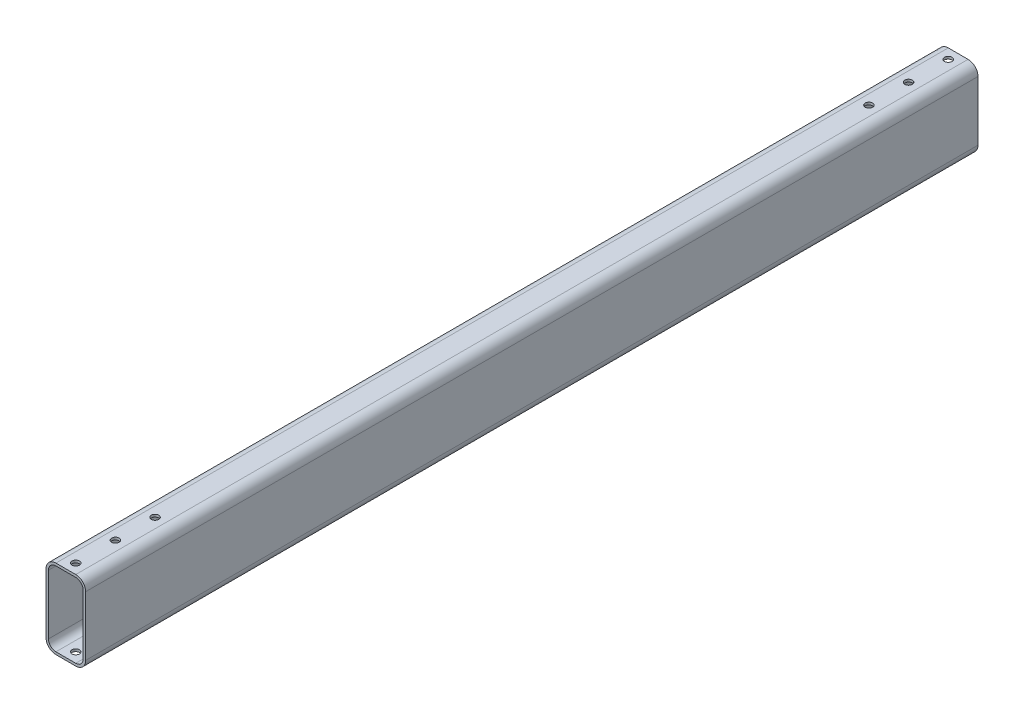
from build123d import *

# Parameters (mm, degrees)
EXTRUDE_THIN1_DEPTH            = 571.5
F_3_16_0_1875_DIAMETER_HOLE1_D = 4.7625


with BuildPart() as part:
    # Sketch1 → Extrude-Thin1 (new body)
    with BuildSketch(Plane.XY):
        with BuildLine():
            Line((-12.7, 19.05), (-12.7, -19.05))
            ThreePointArc((-12.7, -19.05), (-10.840128061, -23.540128061), (-6.35, -25.4))
            Line((-6.35, -25.4), (6.35, -25.4))
            ThreePointArc((6.35, -25.4), (10.840128061, -23.540128061), (12.7, -19.05))
            Line((12.7, -19.05), (12.7, 19.05))
            ThreePointArc((12.7, 19.05), (10.840128061, 23.540128061), (6.35, 25.4))
            Line((6.35, 25.4), (-6.35, 25.4))
            ThreePointArc((-6.35, 25.4), (-10.840128061, 23.540128061), (-12.7, 19.05))
        make_face()
        with BuildLine():
            Line((-11.1125, 19.05), (-11.1125, -19.05))
            ThreePointArc((-11.1125, -19.05), (-9.717596045, -22.417596045), (-6.35, -23.8125))
            Line((-6.35, -23.8125), (6.35, -23.8125))
            ThreePointArc((6.35, -23.8125), (9.717596045, -22.417596045), (11.1125, -19.05))
            Line((11.1125, -19.05), (11.1125, 19.05))
            ThreePointArc((11.1125, 19.05), (9.717596045, 22.417596045), (6.35, 23.8125))
            Line((6.35, 23.8125), (-6.35, 23.8125))
            ThreePointArc((-6.35, 23.8125), (-9.717596045, 22.417596045), (-11.1125, 19.05))
        make_face(mode=Mode.SUBTRACT)
    extrude(amount=EXTRUDE_THIN1_DEPTH)

    # 3/16 (0.1875) Diameter Hole1 (through all)
    with Locations(Plane(origin=(0, 25.4, 565.15), x_dir=(0, 0, 1), z_dir=(0, 1, 0))):
        with Locations((0, 0), (-558.8, 0), (-533.4, 0), (-508, 0), (-25.4, 0), (-50.8, 0)):
            Hole(F_3_16_0_1875_DIAMETER_HOLE1_D / 2)


solid = part.part
